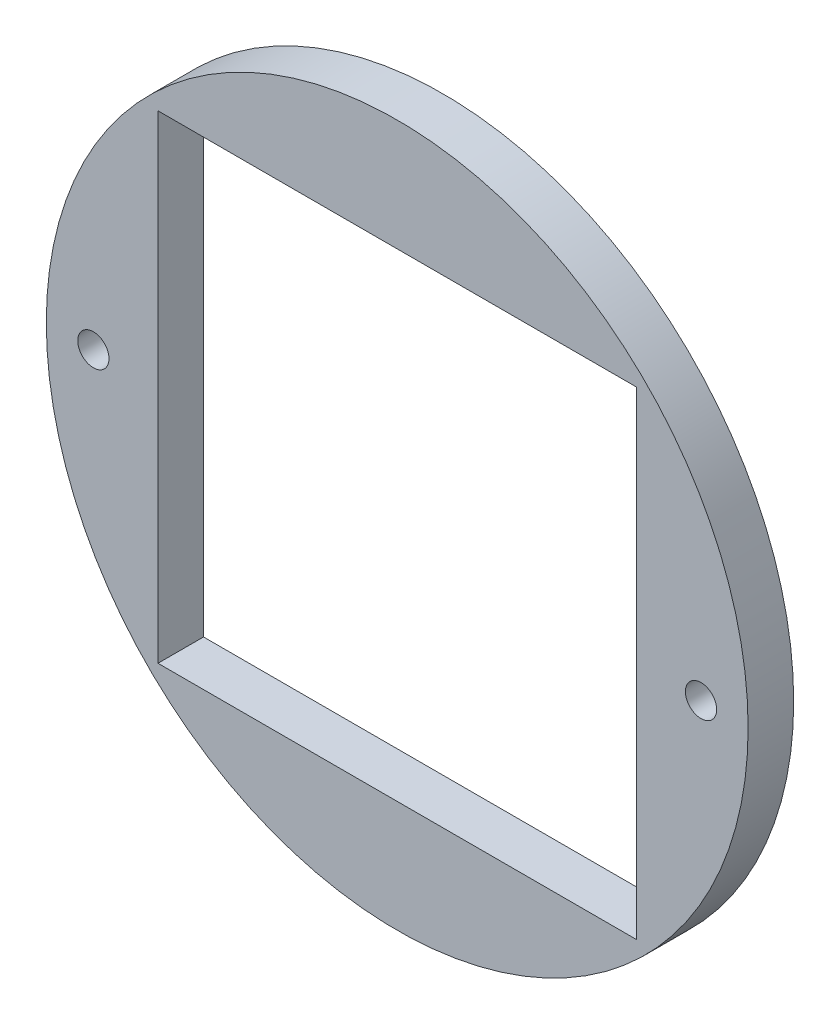
from build123d import *

# Parameters (mm, degrees)
SKETCH1_R               = 73.3425
BOSS_EXTRUDE1_DEPTH     = 9.525
F_1_4_CLEARANCE_HOLE1_D = 6.5278
CUT_EXTRUDE1_DEPTH      = 105.158390145
CUT_EXTRUDE1_DEPTH_BACK = 105.158390145
SKETCH4_W               = 99.999999898
SKETCH4_H               = 99.999999898


with BuildPart() as part:
    # Sketch1 → Boss-Extrude1 (new body)
    with BuildSketch(Plane.XY):
        Circle(SKETCH1_R)
    extrude(amount=BOSS_EXTRUDE1_DEPTH)

    # 1/4 Clearance Hole1 (through all)
    with Locations(Plane.XY.offset(9.525)):
        with Locations((-63.5, 0), (63.5, 0)):
            Hole(F_1_4_CLEARANCE_HOLE1_D / 2)

    # Sketch4 → Cut-Extrude1 (cut, two sides: drawn at the far end of the back side and taken through both)
    with BuildSketch(Plane.XY.offset(9.525).offset(-CUT_EXTRUDE1_DEPTH_BACK)):
        Rectangle(SKETCH4_W, SKETCH4_H)
    extrude(amount=CUT_EXTRUDE1_DEPTH + CUT_EXTRUDE1_DEPTH_BACK, mode=Mode.SUBTRACT)


solid = part.part
